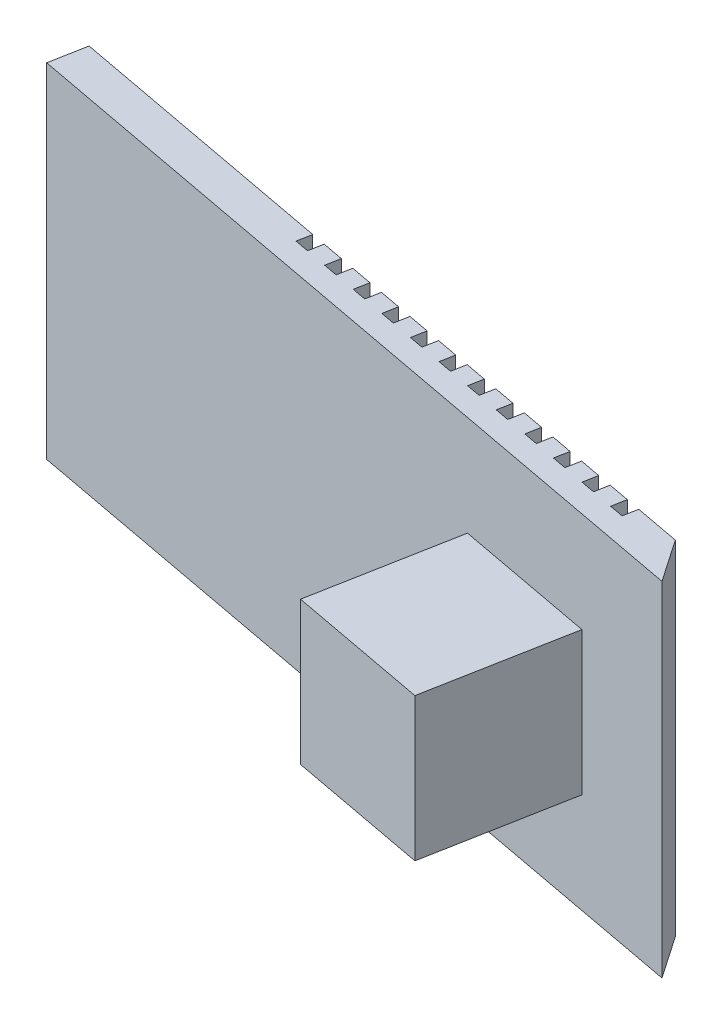
from build123d import *

# Parameters (mm, degrees)
SKETCH1_W           = 56.247710146
SKETCH1_H           = 24
BOSS_EXTRUDE1_DEPTH = 2.54
CHAMFER1_SIZE       = 5
SKETCH2_W           = 1
SKETCH2_H           = 24
CUT_EXTRUDE1_DEPTH  = 1
LPATTERN1_COUNT     = 12
LPATTERN1_PITCH     = 2.5
SKETCH3_W           = 10
SKETCH3_H           = 10
BOSS_EXTRUDE2_DEPTH = 10


with BuildPart() as part:
    # Sketch1 → Boss-Extrude1 (new body)
    with BuildSketch(Plane(origin=(376.193568869, 0, -2012.574360527), x_dir=(-0.9829750210853586, 0, -0.183739238929084), z_dir=(0.183739238929084, 0, -0.9829750210853586))):
        with Locations((-961.949517112, 483.716935274)):
            Rectangle(SKETCH1_W, SKETCH1_H)
    extrude(amount=BOSS_EXTRUDE1_DEPTH)

    # Chamfer1
    # the kernel refuses this chamfer: 5 mm, written as the material it takes off along each edge
    with BuildSketch(Plane(origin=(1349.877660436, 508.575350214, -1833.155789191), x_dir=(-0.15664201033904618, 0, 0.987655446295388), z_dir=(0, -1, 0))) as chamfer1_piece_1:
        Polygon((CHAMFER1_SIZE * 0.999621916911, CHAMFER1_SIZE * 0.0274958766106), (-CHAMFER1_SIZE * 0.0274958766106, CHAMFER1_SIZE * 0.999621916911), (0, 0), align=None)
    extrude(amount=49.71682988, mode=Mode.SUBTRACT)

    # Sketch2 → Cut-Extrude1 (cut)
    with BuildSketch(Plane(origin=(376.660266536, 0, -2015.07111708), x_dir=(-0.9829750210853584, 0, -0.18373923892908509), z_dir=(0.18373923892908506, 0, -0.9829750210853583))):
        with Locations((-981.377561484, 483.716935274)):
            Rectangle(SKETCH2_W, SKETCH2_H)
    cut_extrude1 = extrude(amount=-CUT_EXTRUDE1_DEPTH, mode=Mode.SUBTRACT)

    # LPattern1: Cut-Extrude1 ×12
    with Locations(*[Vector(-0.9829750210853567, 0, -0.18373923892909338) * (i * LPATTERN1_PITCH) for i in range(1, LPATTERN1_COUNT)]):
        add(cut_extrude1, mode=Mode.SUBTRACT)

    # Sketch3 → Boss-Extrude2 (add)
    with BuildSketch(Plane(origin=(376.193568869, 0, -2012.574360527), x_dir=(0.9829750210853584, 0, 0.18373923892908509), z_dir=(-0.18373923892908506, 0, 0.9829750210853583))):
        with Locations((975.613372185, 483.716935274)):
            Rectangle(SKETCH3_W, SKETCH3_H)
    extrude(amount=BOSS_EXTRUDE2_DEPTH)


solid = part.part
